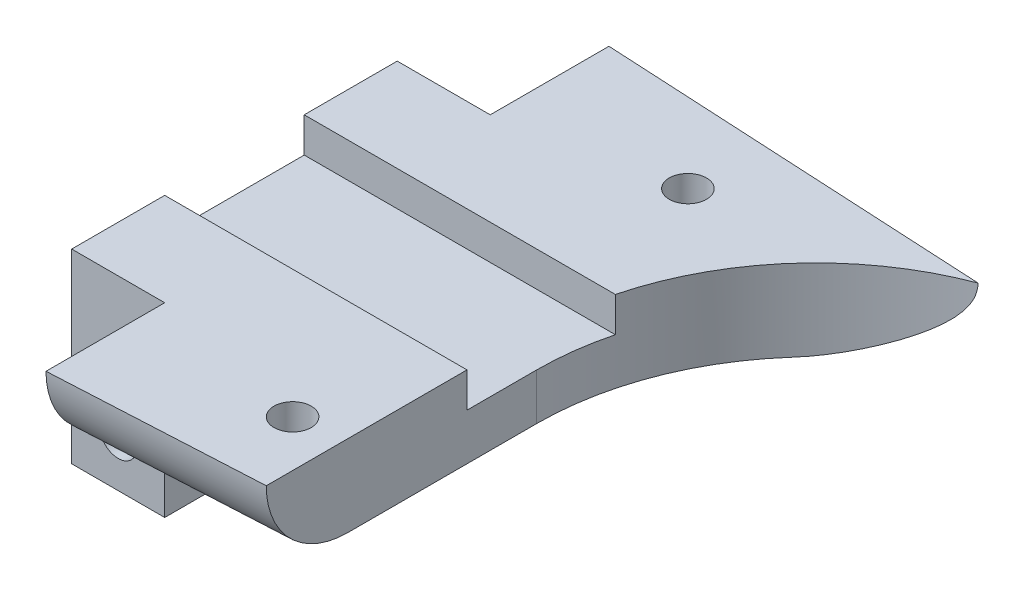
from build123d import *

# Parameters (mm, degrees)
BOSS_EXTRUDE1_DEPTH = 3.5
SKETCH2_R           = 0.8
SCREW_HOLES_DEPTH   = 37.028935124
SKETCH3_W           = 4
SKETCH3_H           = 14
BOSS_EXTRUDE2_DEPTH = 8
CUT_EXTRUDE1_DEPTH  = 1.5
CUT_EXTRUDE2_START  = 13
SKETCH5_R           = 0.8
CUT_EXTRUDE2_DEPTH  = 50.74008936
FILLET1_R           = 3.5


with BuildPart() as part:
    # Sketch1 → Boss-Extrude1 (new body)
    with BuildSketch(Plane(origin=(0, 0, 0), x_dir=(1, 0, 0), z_dir=(0, 1, 0))):
        with BuildLine():
            Line((17, -10), (17, -12.105263158))
            Line((17, -12.105263158), (26, -11.631578947))
            Line((26, -11.631578947), (26, 0))
            ThreePointArc((26, 0), (28.126845638, 6.820617489), (33.753470489, 11.223501553))
            Line((33.753470489, 11.223501553), (17, 12.105263158))
            Line((17, 12.105263158), (17, 10))
            Line((17, 10), (17, 7))
            Line((17, 7), (13, 7))
            Line((13, 7), (13, 0))
            Line((13, 0), (13, -7))
            Line((13, -7), (17, -7))
            Line((17, -7), (17, -10))
        make_face()
    extrude(amount=-BOSS_EXTRUDE1_DEPTH)

    # Sketch2 → Screw Holes (cut, through all)
    with BuildSketch(Plane(origin=(0, 0, 0), x_dir=(1, 0, 0), z_dir=(0, 1, 0))):
        with Locations(Location((24, 8.5, 0), (0, 0, 270))):
            Circle(SKETCH2_R)
        with Locations(Location((24, -8.5, 0), (0, 0, 270))):
            Circle(SKETCH2_R)
    extrude(amount=-SCREW_HOLES_DEPTH, mode=Mode.SUBTRACT)

    # Sketch3 → Boss-Extrude2 (add)
    with BuildSketch(Plane(origin=(0, 0, 0), x_dir=(1, 0, 0), z_dir=(0, 1, 0))):
        with Locations((15, 0)):
            Rectangle(SKETCH3_W, SKETCH3_H)
    extrude(amount=-BOSS_EXTRUDE2_DEPTH)

    # Sketch4 → Cut-Extrude1 (cut)
    with BuildSketch(Plane(origin=(0, 0, 0), x_dir=(1, 0, 0), z_dir=(0, 1, 0))):
        Polygon((13, 0), (13, 3), (26.381049961, 3), (26.381049961, -3), (13, -3), align=None)
    extrude(amount=-CUT_EXTRUDE1_DEPTH, mode=Mode.SUBTRACT)

    # Sketch5 → Cut-Extrude2 (cut, through all)
    with BuildSketch(Plane.XY.offset(CUT_EXTRUDE2_START)):
        with Locations((15, -6)):
            Circle(SKETCH5_R)
    extrude(amount=-CUT_EXTRUDE2_DEPTH, mode=Mode.SUBTRACT)

    # Fillet1
    # the kernel refuses this fillet: 3.5 mm, written as the material it takes off along each edge
    with BuildSketch(Plane(origin=(8.262093993, -3.5, 12.565152948), x_dir=(0, 1, 0), z_dir=(0.9986178293325098, 0, -0.05255883312276359))) as fillet1_piece_1_section:
        with BuildLine():
            CenterArc((FILLET1_R, -FILLET1_R), FILLET1_R, 90, 90)
            Line((0, -FILLET1_R), (-FILLET1_R * 0.02, -FILLET1_R))
            Line((-FILLET1_R * 0.02, -FILLET1_R), (-FILLET1_R * 0.02, FILLET1_R * 0.02))
            Line((-FILLET1_R * 0.02, FILLET1_R * 0.02), (FILLET1_R, FILLET1_R * 0.02))
            Line((FILLET1_R, FILLET1_R * 0.02), (FILLET1_R, 0))
        make_face()
    fillet1_piece_1 = extrude(amount=26.512456753, mode=Mode.PRIVATE)
    fillet1_piece_1 = split(fillet1_piece_1, bisect_by=Plane(origin=(17, -2.7076171, 11.074941428), z_dir=(1, 0, 0)), keep=Keep.TOP, mode=Mode.PRIVATE)
    fillet1_piece_1 = split(fillet1_piece_1, bisect_by=Plane(origin=(26, -2.7076171, 11.074941428), z_dir=(-1, 0, 0)), keep=Keep.TOP, mode=Mode.PRIVATE)
    add(fillet1_piece_1, mode=Mode.SUBTRACT)
    with BuildSketch(Plane(origin=(42.491376496, -3.5, -10.763611763), x_dir=(-0.05255883312276374, 0, 0.9986178293325098), z_dir=(-0.9986178293325098, 0, -0.05255883312276374))) as fillet1_piece_2_section:
        with BuildLine():
            CenterArc((FILLET1_R, FILLET1_R), FILLET1_R, 180, 90)
            Line((0, FILLET1_R), (-FILLET1_R * 0.02, FILLET1_R))
            Line((-FILLET1_R * 0.02, FILLET1_R), (-FILLET1_R * 0.02, -FILLET1_R * 0.02))
            Line((-FILLET1_R * 0.02, -FILLET1_R * 0.02), (FILLET1_R, -FILLET1_R * 0.02))
            Line((FILLET1_R, -FILLET1_R * 0.02), (FILLET1_R, 0))
        make_face()
    fillet1_piece_2 = extrude(amount=34.276658695, mode=Mode.PRIVATE)
    fillet1_piece_2 = split(fillet1_piece_2, bisect_by=Plane(origin=(17, -2.672351217, -10.961883327), z_dir=(1, 0, 0)), keep=Keep.TOP, mode=Mode.PRIVATE)
    fillet1_piece_2 = fillet1_piece_2 - Plane(origin=(38, -2.672351217, 0), x_dir=(-1, 0, 0), z_dir=(0, 1, 0)) * Cylinder(12, 83, mode=Mode.PRIVATE)
    add(fillet1_piece_2, mode=Mode.SUBTRACT)


solid = part.part
